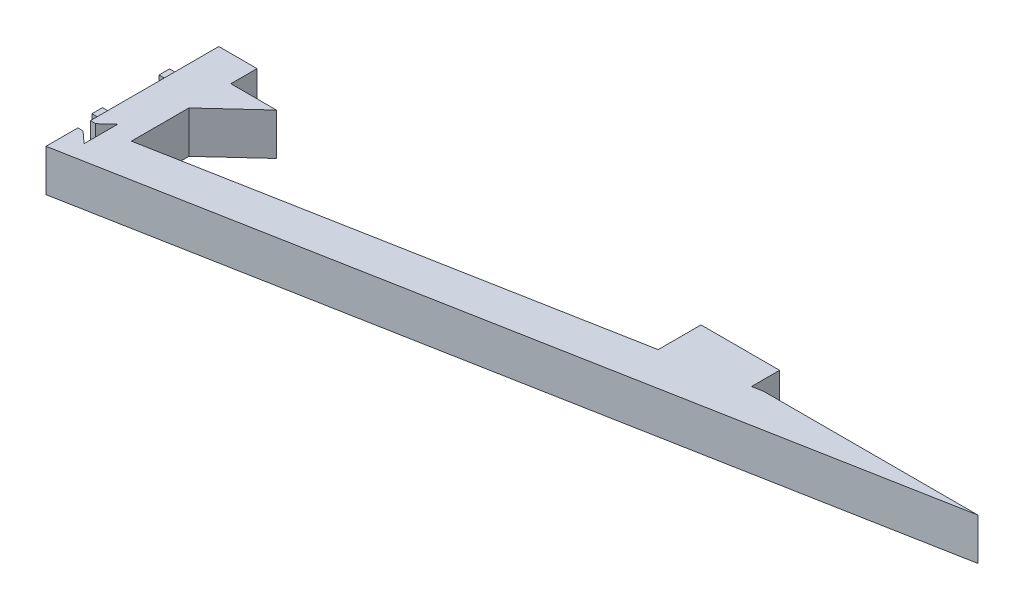
from build123d import *

# Parameters (mm, degrees)
P_IDAT_VYSUNUT_M1_DEPTH  = 8
ODEBRAT_VYSUNUT_M1_DEPTH = 154.64258329
SKICA3_W                 = 2
SKICA3_H                 = 2
P_IDAT_VYSUNUT_M2_DEPTH  = 4
SKICA5_W                 = 16
SKICA5_H                 = 8
P_IDAT_VYSUNUT_M4_DEPTH  = 8
ODEBRAT_VYSUNUT_M3_DEPTH = 154.64258329


with BuildPart() as part:
    # Skica1 → Přidat vysunutím1 (new body)
    with BuildSketch(Plane(origin=(0, 0, 0), x_dir=(1, 0, 0), z_dir=(0, 1, 0))):
        Polygon((0, 0), (0, -32.97), (149.85, -5), (108.974598174, -5), (107, -5.368565305), (107, 0), (92, 0), (92, -8.168365105), (7.3, -23.977901307), (7.3, 0), align=None)
    extrude(amount=P_IDAT_VYSUNUT_M1_DEPTH)

    # Skica2 → Odebrat vysunutím1 (cut, through all)
    with BuildSketch(Plane(origin=(0, 8, 0), x_dir=(1, 0, 0), z_dir=(0, 1, 0))):
        Polygon((0, -24.5), (1, -24.5), (3.2, -22.5), (3.2, -28.9), (1, -26.9), (0, -26.9), align=None)
    extrude(amount=-ODEBRAT_VYSUNUT_M1_DEPTH, mode=Mode.SUBTRACT)

    # Skica3 → Přidat vysunutím2 (add)
    with BuildSketch(Plane.ZY):
        with Locations((6.4, 4)):
            Rectangle(SKICA3_W, SKICA3_H)
        with Locations((19.2, 4)):
            Rectangle(SKICA3_W, SKICA3_H)
    extrude(amount=P_IDAT_VYSUNUT_M2_DEPTH)

    # Skica5 → Přidat vysunutím4 (add)
    with BuildSketch(Plane(origin=(0, 8, 0), x_dir=(1, 0, 0), z_dir=(0, 1, 0))):
        with Locations((8, -9)):
            Rectangle(SKICA5_W, SKICA5_H)
    extrude(amount=-P_IDAT_VYSUNUT_M4_DEPTH)

    # Skica7 → Odebrat vysunutím3 (cut, through all)
    with BuildSketch(Plane.XZ):
        Polygon((7.3, 13), (16, 13), (16, 5), align=None)
    extrude(amount=-ODEBRAT_VYSUNUT_M3_DEPTH, mode=Mode.SUBTRACT)


solid = part.part
